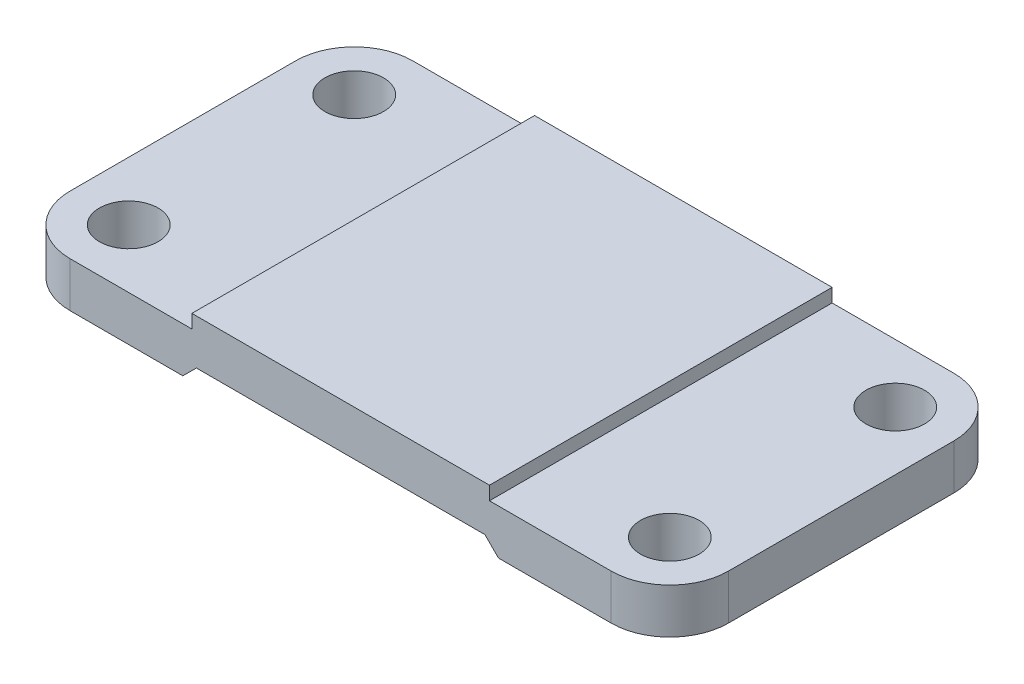
from build123d import *

# Parameters (mm, degrees)
CROQUIS2_W              = 146
CROQUIS2_H              = 76
SALIENTE_EXTRUIR2_DEPTH = 10
CROQUIS3_W              = 66
CROQUIS3_H              = 76
SALIENTE_EXTRUIR3_DEPTH = 3
REDONDEO1_R             = 13
REDONDEO2_R             = 13
REDONDEO3_R             = 13
REDONDEO4_R             = 13
CROQUIS5_R              = 6.5
CORTAR_EXTRUIR1_DEPTH   = 83.903558428
CROQUIS6_W              = 72
CROQUIS6_H              = 76
CORTAR_EXTRUIR2_DEPTH   = 3
CHAFL_N1_SIZE           = 4
CHAFL_N2_SIZE           = 4


with BuildPart() as part:
    # Croquis2 → Saliente-Extruir2 (new body)
    with BuildSketch(Plane(origin=(0, 0, 0), x_dir=(1, 0, 0), z_dir=(0, 1, 0))):
        Rectangle(CROQUIS2_W, CROQUIS2_H)
    extrude(amount=SALIENTE_EXTRUIR2_DEPTH)

    # Croquis3 → Saliente-Extruir3 (add)
    with BuildSketch(Plane(origin=(0, 10, 0), x_dir=(1, 0, 0), z_dir=(0, 1, 0))):
        Rectangle(CROQUIS3_W, CROQUIS3_H)
    extrude(amount=SALIENTE_EXTRUIR3_DEPTH)

    # Redondeo1
    redondeo1_edges = [part.edges().sort_by_distance(p)[0] for p in [
        (-73, 5, -38),
    ]]
    fillet(redondeo1_edges, radius=REDONDEO1_R)

    # Redondeo2
    redondeo2_edges = [part.edges().sort_by_distance(p)[0] for p in [
        (-73, 5, 38),
    ]]
    fillet(redondeo2_edges, radius=REDONDEO2_R)

    # Redondeo3
    redondeo3_edges = [part.edges().sort_by_distance(p)[0] for p in [
        (73, 5, 38),
    ]]
    fillet(redondeo3_edges, radius=REDONDEO3_R)

    # Redondeo4
    redondeo4_edges = [part.edges().sort_by_distance(p)[0] for p in [
        (73, 5, -38),
    ]]
    fillet(redondeo4_edges, radius=REDONDEO4_R)

    # Croquis5 → Cortar-Extruir1 (cut, through all)
    with BuildSketch(Plane(origin=(0, 10, 0), x_dir=(1, 0, 0), z_dir=(0, 1, 0))):
        with Locations(Location((-60, 25, 0), (0, 0, 270))):
            Circle(CROQUIS5_R)
        with Locations(Location((-60, -25, 0), (0, 0, 270))):
            Circle(CROQUIS5_R)
        with Locations(Location((60, -25, 0), (0, 0, 270))):
            Circle(CROQUIS5_R)
        with Locations(Location((60, 25, 0), (0, 0, 270))):
            Circle(CROQUIS5_R)
    extrude(amount=-CORTAR_EXTRUIR1_DEPTH, mode=Mode.SUBTRACT)

    # Croquis6 → Cortar-Extruir2 (cut)
    with BuildSketch(Plane.XZ):
        Rectangle(CROQUIS6_W, CROQUIS6_H)
    extrude(amount=-CORTAR_EXTRUIR2_DEPTH, mode=Mode.SUBTRACT)

    # Chaflán1
    # the kernel refuses this chamfer: 4 mm, written as the material it adds along each edge
    with BuildSketch(Plane(origin=(-36, 3, 38), x_dir=(-0.027495876610585623, -0.9996219169112968, 0), z_dir=(0, 0, -1))) as chafl_n1_piece_1_section:
        Polygon((CHAFL_N1_SIZE * 0.999621916911, -CHAFL_N1_SIZE * 0.0274958766106), (-CHAFL_N1_SIZE * 0.0274958766106, -CHAFL_N1_SIZE * 0.999621916911), (0, 0), align=None)
    chafl_n1_piece_1 = extrude(amount=76, mode=Mode.PRIVATE)
    chafl_n1_piece_1 = split(chafl_n1_piece_1, bisect_by=Plane(origin=(-34.592163559, 0, 0), z_dir=(0, 1, 0)), keep=Keep.TOP, mode=Mode.PRIVATE)
    add(chafl_n1_piece_1)

    # Chaflán2
    # the kernel refuses this chamfer: 4 mm, written as the material it adds along each edge
    with BuildSketch(Plane(origin=(36, 3, -38), x_dir=(0.027495876610585623, -0.9996219169112968, 0), z_dir=(0, 0, 1))) as chafl_n2_piece_1_section:
        Polygon((CHAFL_N2_SIZE * 0.999621916911, -CHAFL_N2_SIZE * 0.0274958766106), (-CHAFL_N2_SIZE * 0.0274958766106, -CHAFL_N2_SIZE * 0.999621916911), (0, 0), align=None)
    chafl_n2_piece_1 = extrude(amount=76, mode=Mode.PRIVATE)
    chafl_n2_piece_1 = split(chafl_n2_piece_1, bisect_by=Plane(origin=(34.592163559, 0, 0), z_dir=(0, 1, 0)), keep=Keep.TOP, mode=Mode.PRIVATE)
    add(chafl_n2_piece_1)


solid = part.part
